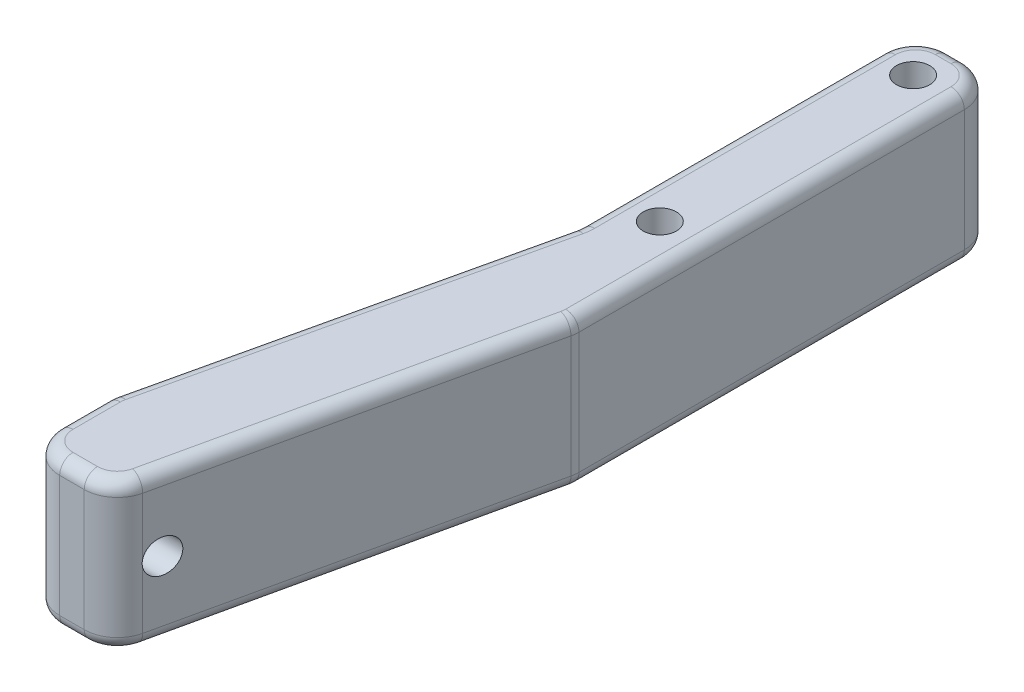
from build123d import *

# Parameters (mm, degrees)
SKETCH2_R           = 2.5
BOSS_EXTRUDE1_DEPTH = 22.2504
CUT_EXTRUDE1_REACH  = 127.286
SKETCH3_R           = 2.5
FILLET2_R           = 5
FILLET3_R           = 2


with BuildPart() as part:
    # Sketch2 → Boss-Extrude1 (new body)
    with BuildSketch(Plane(origin=(0, 0, 0), x_dir=(1, 0, 0), z_dir=(0, 1, 0))):
        Polygon((-25.4, -107.95), (-12.35, -50.8), (-12.35, 0), (0, 0), (0, -63.5), (-12.7, -120.65), (-25.4, -120.65), align=None)
        with Locations(Location((-6.35, -44.45, 0), (0, 0, 90))):
            Circle(SKETCH2_R, mode=Mode.SUBTRACT)
        with Locations(Location((-6.35, -6.35, 0), (0, 0, 90))):
            Circle(SKETCH2_R, mode=Mode.SUBTRACT)
    extrude(amount=BOSS_EXTRUDE1_DEPTH)

    # Cut-Extrude1: up to this plane
    cut_extrude1_end = Plane(origin=(13.447058824, 22.2504, 2.988235294), z_dir=(-0.9761870601839527, 0, -0.21693045781865627))
    # Sketch3 → Cut-Extrude1 (cut, up to the surface)
    with BuildSketch(Plane.ZY.offset(25.4), mode=Mode.PRIVATE) as cut_extrude1_sk1:
        with Locations((114.3, 11.1252)):
            Circle(SKETCH3_R)
    cut_extrude1_tool1 = split(extrude(cut_extrude1_sk1.sketch, amount=-CUT_EXTRUDE1_REACH, mode=Mode.PRIVATE), bisect_by=cut_extrude1_end, keep=Keep.BOTH, mode=Mode.PRIVATE)
    add(cut_extrude1_tool1.solids().sort_by_distance((-25.4, 11.1252, 114.3))[0], mode=Mode.SUBTRACT)

    # Fillet2
    # the kernel refuses this fillet: 5 mm, written as the material it adds along each edge
    with BuildSketch(Plane(origin=(-12.35, 0, 50.8), x_dir=(-0.22261635970063726, 0, 0.9749061269648666), z_dir=(0, 1, 0))) as fillet2_piece_1:
        with BuildLine():
            CenterArc((FILLET2_R * 0.112722501926, -FILLET2_R), FILLET2_R, 90, 12.862751019)
            Line((-FILLET2_R * 0.109893857775, -FILLET2_R * 0.0250938730351), (0, 0))
            Line((0, 0), (FILLET2_R * 0.112722501926, 0))
        make_face()
    extrude(amount=22.2504)
    # the kernel refuses this fillet: 5 mm, written as the material it takes off along each edge
    with BuildSketch(Plane(origin=(-12.35, -12.5, 0), x_dir=(0, 0, 1), z_dir=(0, 1, 0)), Plane(origin=(0, -12.5, 0), x_dir=(-1, 0, 0), z_dir=(0, 1, 0))) as fillet2_2_piece_1:
        with BuildLine():
            CenterArc((FILLET2_R, FILLET2_R), FILLET2_R, 180, 90)
            Line((0, FILLET2_R), (0, 0))
            Line((0, 0), (FILLET2_R, 0))
        make_face()
    extrude(amount=47.2504, mode=Mode.SUBTRACT)
    with BuildSketch(Plane(origin=(0, -1.372152858, 63.5), x_dir=(0, 0, -1), z_dir=(0, 1, 0))) as fillet2_2_piece_2:
        with BuildLine():
            CenterArc((FILLET2_R * 0.109772228646, FILLET2_R), FILLET2_R, 257.471192291, 12.528807709)
            Line((-FILLET2_R * 0.107158229172, FILLET2_R * 0.023812939816), (0, 0))
            Line((0, 0), (FILLET2_R * 0.109772228646, 0))
        make_face()
    extrude(amount=24.994705716, mode=Mode.SUBTRACT)
    with BuildSketch(Plane(origin=(-12.7, -10.02714508, 120.65), x_dir=(0.21693045781865597, 0, -0.9761870601839527), z_dir=(0, 1, 0))) as fillet2_2_piece_3:
        with BuildLine():
            CenterArc((FILLET2_R * 0.802171606366, FILLET2_R), FILLET2_R, 192.528807709, 77.471192291)
            Line((-FILLET2_R * 0.174015453818, FILLET2_R * 0.783069542181), (0, 0))
            Line((0, 0), (FILLET2_R * 0.802171606366, 0))
        make_face()
    extrude(amount=42.304690159, mode=Mode.SUBTRACT)
    with BuildSketch(Plane(origin=(-25.4, -12.5, 120.65), x_dir=(0, 0, -1), z_dir=(0, 1, 0))) as fillet2_2_piece_4:
        with BuildLine():
            CenterArc((FILLET2_R, -FILLET2_R), FILLET2_R, 90, 90)
            Line((0, -FILLET2_R), (0, 0))
            Line((0, 0), (FILLET2_R, 0))
        make_face()
    extrude(amount=47.2504, mode=Mode.SUBTRACT)
    with BuildSketch(Plane(origin=(-25.4, -1.409031274, 107.95), x_dir=(0.2226163597006375, 0, -0.9749061269648664), z_dir=(0, 1, 0))) as fillet2_2_piece_5:
        with BuildLine():
            CenterArc((FILLET2_R * 0.112722501926, -FILLET2_R), FILLET2_R, 90, 12.862751019)
            Line((-FILLET2_R * 0.109893857775, -FILLET2_R * 0.0250938730351), (0, 0))
            Line((0, 0), (FILLET2_R * 0.112722501926, 0))
        make_face()
    extrude(amount=25.068462548, mode=Mode.SUBTRACT)

    # Fillet3
    fillet3_edges = [part.edges().sort_by_distance(p)[0] for p in [
        (-6.175, 0, 0),
        (-6.175, 22.2504, 0),
        (-18.875, 0, 79.375),
        (-12.35, 0, 27.618193745),
        (0, 0, 33.975569428),
        (-5.974493715, 0, 90.385221717),
        (-18.555429016, 0, 120.65),
        (-25.4, 0, 112.081806255),
        (-13.582221064, 0, 119.550209061),
        (-23.935533906, 0, 119.185533906),
        (-25.368533646, 0, 107.953546966),
        (-10.885533906, 0, 1.464466094),
        (-0.029855309, 0, 63.496722716),
        (-1.464466094, 0, 1.464466094),
        (0, 22.2504, 33.975569428),
        (-18.875, 22.2504, 79.375),
        (-25.4, 22.2504, 112.081806255),
        (-18.555429016, 22.2504, 120.65),
        (-5.974493715, 22.2504, 90.385221717),
        (-12.35, 22.2504, 27.618193745),
        (-13.582221064, 22.2504, 119.550209061),
        (-23.935533906, 22.2504, 119.185533906),
        (-25.368533646, 22.2504, 107.953546966),
        (-10.885533906, 22.2504, 1.464466094),
        (-0.029855309, 22.2504, 63.496722716),
        (-1.464466094, 22.2504, 1.464466094),
        (-12.381466354, 0, 50.796453034),
        (-12.381466354, 22.2504, 50.796453034),
    ]]
    fillet(fillet3_edges, radius=FILLET3_R)


solid = part.part
